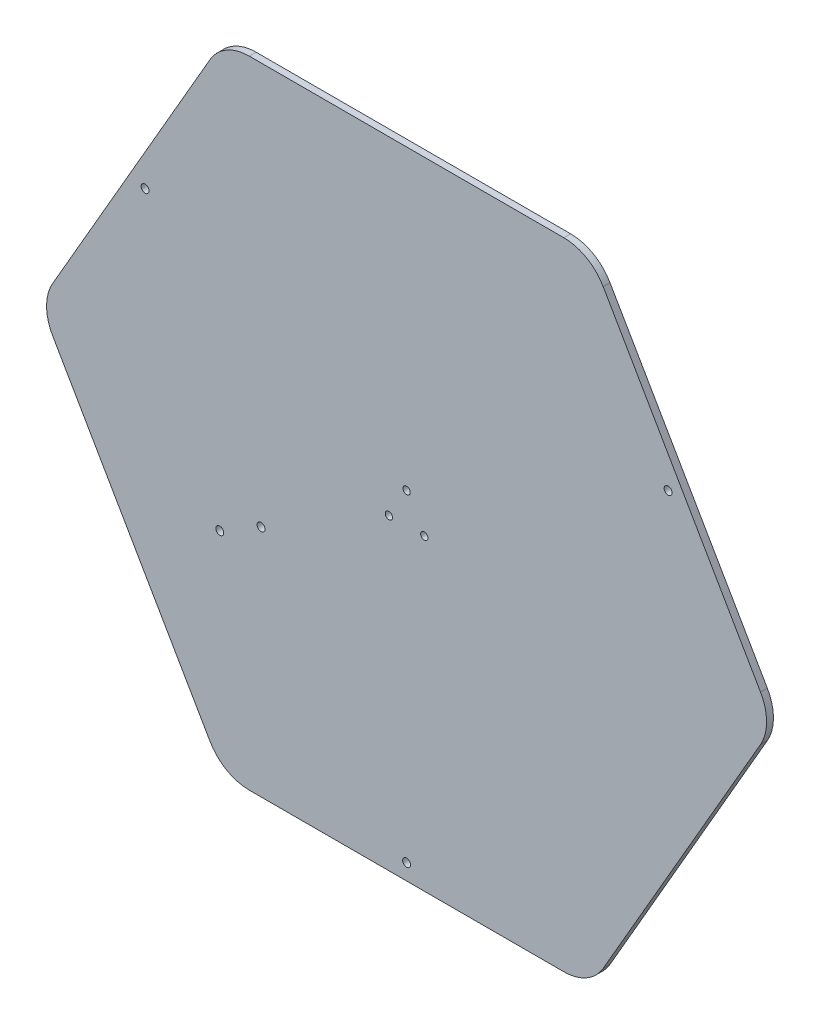
from build123d import *

# Parameters (mm, degrees)
SALIENTE_EXTRUIR1_DEPTH = 3
REDONDEO1_R             = 20
CROQUIS2_R              = 1.75
CORTAR_EXTRUIR1_DEPTH   = 212.545651301
CROQUIS3_R              = 1.75
CORTAR_EXTRUIR2_DEPTH   = 229.395238751
CROQUIS4_R              = 1.6
CORTAR_EXTRUIR3_DEPTH   = 3


with BuildPart() as part:
    # Croquis1 → Saliente-Extruir1 (new body)
    with BuildSketch(Plane.XY):
        Polygon((-80.829037687, -140), (80.829037687, -140), (161.658075373, 0), (80.829037687, 140), (-80.829037687, 140), (-161.658075373, 0), align=None)
    extrude(amount=SALIENTE_EXTRUIR1_DEPTH)

    # Redondeo1
    redondeo1_edges = [part.edges().sort_by_distance(p)[0] for p in [
        (80.829037687, 140, 1.5),
        (-80.829037687, 140, 1.5),
        (-161.658075373, 0, 1.5),
        (-80.829037687, -140, 1.5),
        (80.829037687, -140, 1.5),
        (161.658075373, 0, 1.5),
    ]]
    fillet(redondeo1_edges, radius=REDONDEO1_R)

    # Croquis2 → Cortar-Extruir1 (cut, through all)
    with BuildSketch(Plane(origin=(0, 0, 0), x_dir=(1, 0, 0), z_dir=(0, 0, -1))):
        with Locations((0, 133)):
            Circle(CROQUIS2_R)
        with Locations((115.181378703, -66.5)):
            Circle(CROQUIS2_R)
        with Locations((-115.181378703, -66.5)):
            Circle(CROQUIS2_R)
    extrude(amount=-CORTAR_EXTRUIR1_DEPTH, mode=Mode.SUBTRACT)

    # Croquis3 → Cortar-Extruir2 (cut, through all)
    with BuildSketch(Plane.XY.offset(86.15)):
        with Locations((-64.09392774, -37.004646434)):
            Circle(CROQUIS3_R)
        with Locations((-82.280461219, -47.504646434)):
            Circle(CROQUIS3_R)
    extrude(amount=-CORTAR_EXTRUIR2_DEPTH, mode=Mode.SUBTRACT)

    # Croquis4 → Cortar-Extruir3 (cut)
    with BuildSketch(Plane(origin=(0, 0, 0), x_dir=(1, 0, 0), z_dir=(0, 0, -1))):
        with Locations((7.794228634, 4.5)):
            Circle(CROQUIS4_R)
        with Locations((0, -9)):
            Circle(CROQUIS4_R)
        with Locations((-7.794228634, 4.5)):
            Circle(CROQUIS4_R)
    extrude(amount=-CORTAR_EXTRUIR3_DEPTH, mode=Mode.SUBTRACT)


solid = part.part
